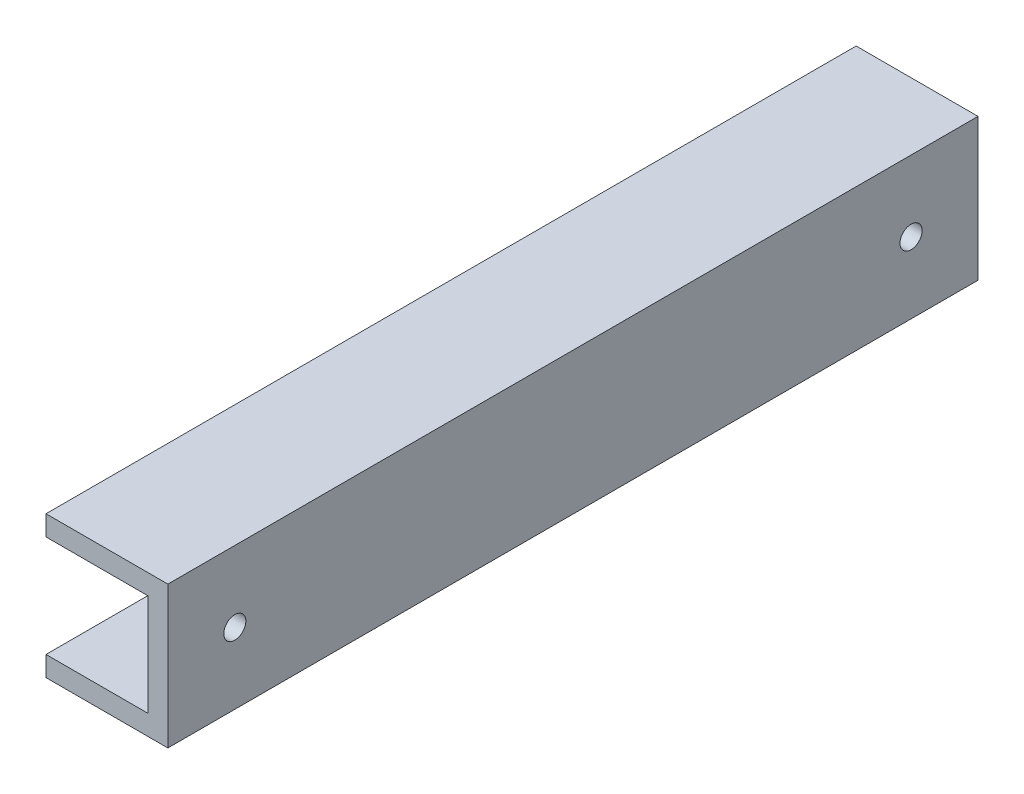
from build123d import *

# Parameters (mm, degrees)
SKETCH_1_W          = 21.2
SKETCH_1_H          = 21.2
SKETCH_1_W_2        = 15.2
SKETCH_1_H_2        = 15.2
EXTRUDE_1_DEPTH     = 121
SKETCH_2_R          = 1.65
CUT_EXTRUDE_1_DEPTH = 30
SKETCH_3_W          = 314.053168424
SKETCH_3_H          = 46.219516436
CUT_EXTRUDE_2_DEPTH = 3
SKETCH_4_W          = 5
SKETCH_4_H          = 15.2
EXTRUDE_1_2_DEPTH   = 10
SKETCH_5_W          = 61
SKETCH_5_H          = 5
EXTRUDE_2_DEPTH     = 10
SKETCH_6_W          = 71
SKETCH_6_H          = 15.2
EXTRUDE_3_DEPTH     = 10
SKETCH_8_W          = 71
SKETCH_8_H          = 5
CUT_EXTRUDE_3_DEPTH = 3
CHAMFER_1_SIZE      = 3
CHAMFER_2_SIZE      = 4


with BuildPart() as part:
    # 草图1 → Extrude 1 (new body)
    with BuildSketch(Plane.XY):
        with Locations((7.6, 7.6)):
            Rectangle(SKETCH_1_W, SKETCH_1_H)
        with Locations((7.6, 7.6)):
            Rectangle(SKETCH_1_W_2, SKETCH_1_H_2, mode=Mode.SUBTRACT)
    extrude(amount=EXTRUDE_1_DEPTH)

    # 草图2 → 切除-拉伸1 (cut)
    with BuildSketch(Plane.ZY.offset(3)):
        with Locations((10, 7.6)):
            Circle(SKETCH_2_R)
        with Locations((111, 7.6)):
            Circle(SKETCH_2_R)
    extrude(amount=-CUT_EXTRUDE_1_DEPTH, mode=Mode.SUBTRACT)

    # 草图3 → 切除-拉伸2 (cut)
    with BuildSketch(Plane.ZY.offset(3)):
        with Locations((151.731232528, 0.202739406)):
            Rectangle(SKETCH_3_W, SKETCH_3_H)
    extrude(amount=-CUT_EXTRUDE_2_DEPTH, mode=Mode.SUBTRACT)

    # 草图4 → Extrude 1 2 (add)
    with BuildSketch(Plane.ZY.offset(-15.2)):
        with Locations((27.5, 7.6)):
            Rectangle(SKETCH_4_W, SKETCH_4_H)
        with Locations((93.5, 7.6)):
            Rectangle(SKETCH_4_W, SKETCH_4_H)
    extrude(amount=EXTRUDE_1_2_DEPTH)

    # 草图5 → 凸台-拉伸2 (add)
    with BuildSketch(Plane.ZY.offset(-15.2)):
        with Locations((60.5, 7.6)):
            Rectangle(SKETCH_5_W, SKETCH_5_H)
    extrude(amount=EXTRUDE_2_DEPTH)

    # 草图6 → 凸台-拉伸3 (add)
    with BuildSketch(Plane.ZY.offset(-15.2)):
        with Locations((60.5, 7.6)):
            Rectangle(SKETCH_6_W, SKETCH_6_H)
    extrude(amount=EXTRUDE_3_DEPTH)

    # 草图8 → 切除-拉伸3 (cut)
    with BuildSketch(Plane.ZY.offset(-5.2)):
        with Locations((60.5, 7.6)):
            Rectangle(SKETCH_8_W, SKETCH_8_H)
    extrude(amount=-CUT_EXTRUDE_3_DEPTH, mode=Mode.SUBTRACT)

    # 倒角1
    chamfer_1_edges = [part.edges().sort_by_distance(p)[0] for p in [
        (8.2, 7.6, 25),
        (8.2, 7.6, 96),
    ]]
    chamfer(chamfer_1_edges, length=CHAMFER_1_SIZE)

    # 倒角2
    chamfer_2_edges = [part.edges().sort_by_distance(p)[0] for p in [
        (15.2, 7.6, 25),
        (15.2, 7.6, 96),
    ]]
    chamfer(chamfer_2_edges, length=CHAMFER_2_SIZE - 0.0001)  # a hair under: the kernel refuses the full size


solid = part.part
